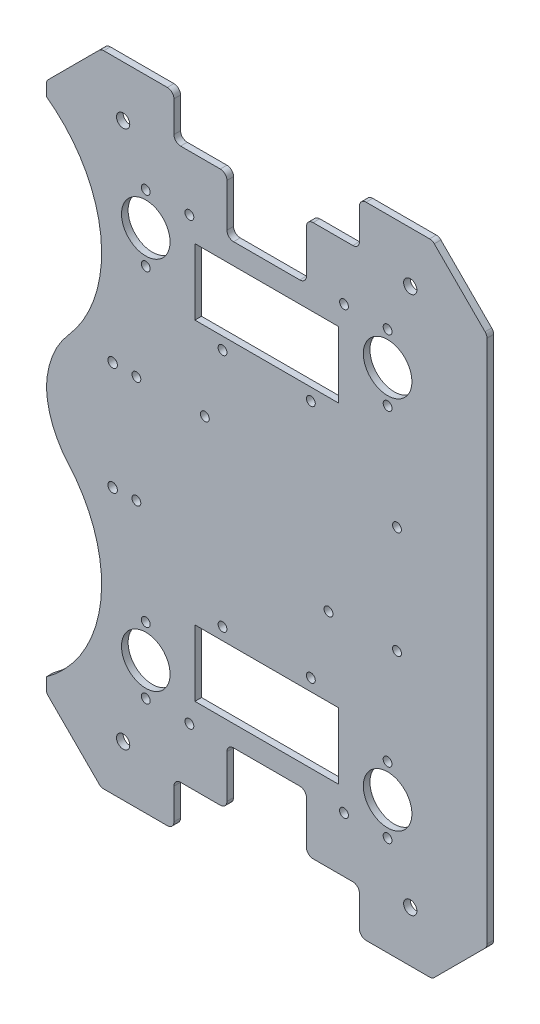
from build123d import *

# Parameters (mm, degrees)
BASE_DEPTH                = 3
ESQUISSE3_R               = 2
ESQUISSE3_W               = 65
ESQUISSE3_H               = 30
ENL_V_MAT_EXTRU_1_DEPTH   = 339.164026842
CONG_1_R                  = 3
PER_AGE_POUR_BILLES_REACH = 340.164
ESQUISSE6_R               = 2
ESQUISSE6_R_2             = 11
PER_AGE_POUR_PROFIL_REACH = 340.164
ESQUISSE8_R               = 3
ESQUISSE11_R              = 2.15
ENL_V_MAT_EXTRU_4_DEPTH   = 339.164026842
ENL_V_MAT_EXTRU_5_REACH   = 340.164
ESQUISSE12_R              = 60
CONG_2_R                  = 40
PER_AGE_BLOC_MOTEUR_REACH = 340.164
ESQUISSE13_R              = 2


with BuildPart() as part:
    # Esquisse1 → Base (new body)
    with BuildSketch(Plane.XY):
        Polygon((0, 0), (-150, 0), (-174.748737342, 24.748737342), (-174.748737342, 264.748737342), (-150, 289.497474683), (0, 289.497474683), (24.748737342, 264.748737342), (24.748737342, 24.748737342), align=None)
    extrude(amount=BASE_DEPTH)

    # Esquisse3 → Enlèv. mat.-Extru.1 (cut, through all)
    with BuildSketch(Plane(origin=(0, 0, 0), x_dir=(-1, 0, 0), z_dir=(0, 0, -1))):
        with Locations((40, 45)):
            Circle(ESQUISSE3_R)
        with Locations(Location((110, 45, 0), (0, 0, 180))):
            Circle(ESQUISSE3_R)
        with Locations((110, 244.497474683)):
            Circle(ESQUISSE3_R)
        with Locations(Location((40, 244.497474683, 0), (0, 0, 180))):
            Circle(ESQUISSE3_R)
        Polygon((117, 0), (117, 20), (93, 20), (93, 45.5), (57, 45.5), (57, 20), (33, 20), (33, 0), align=None)
        Polygon((33, 289.497474683), (117, 289.497474683), (117, 269.497474683), (93, 269.497474683), (93, 243.997474683), (57, 243.997474683), (57, 269.497474683), (33, 269.497474683), align=None)
        with Locations((75, 219.497474683)):
            Rectangle(ESQUISSE3_W, ESQUISSE3_H)
        with Locations((75, 70)):
            Rectangle(ESQUISSE3_W, ESQUISSE3_H)
    extrude(amount=-ENL_V_MAT_EXTRU_1_DEPTH, mode=Mode.SUBTRACT)

    # Congé1
    cong_1_edges = [part.edges().sort_by_distance(p)[0] for p in [
        (0, 0, 1.5),
        (-150, 0, 1.5),
        (-174.748737342, 24.748737342, 1.5),
        (-174.748737342, 264.748737342, 1.5),
        (-150, 289.497474683, 1.5),
        (0, 289.497474683, 1.5),
        (24.748737342, 264.748737342, 1.5),
        (24.748737342, 24.748737342, 1.5),
        (-33, 269.497474683, 1.5),
        (-33, 289.497474683, 1.5),
        (-117, 289.497474683, 1.5),
        (-117, 269.497474683, 1.5),
        (-93, 269.497474683, 1.5),
        (-93, 243.997474683, 1.5),
        (-57, 243.997474683, 1.5),
        (-57, 269.497474683, 1.5),
        (-117, 0, 1.5),
        (-33, 0, 1.5),
        (-33, 20, 1.5),
        (-57, 20, 1.5),
        (-57, 45.5, 1.5),
        (-93, 45.5, 1.5),
        (-93, 20, 1.5),
        (-117, 20, 1.5),
    ]]
    fillet(cong_1_edges, radius=CONG_1_R)

    # Esquisse6 → Perçage pour billes (cut, up to next)
    with BuildSketch(Plane.XY.offset(3), mode=Mode.PRIVATE) as per_age_pour_billes_sk1:
        with Locations((-129.748737342, 45)):
            Circle(ESQUISSE6_R)
    per_age_pour_billes_tool1 = extrude(per_age_pour_billes_sk1.sketch, amount=-PER_AGE_POUR_BILLES_REACH, mode=Mode.PRIVATE) & part.part
    # Esquisse6 → Perçage pour billes (cut, up to next)
    with BuildSketch(Plane.XY.offset(3), mode=Mode.PRIVATE) as per_age_pour_billes_sk2:
        with Locations((-129.748737342, 75)):
            Circle(ESQUISSE6_R)
    per_age_pour_billes_tool2 = extrude(per_age_pour_billes_sk2.sketch, amount=-PER_AGE_POUR_BILLES_REACH, mode=Mode.PRIVATE) & part.part
    # Esquisse6 → Perçage pour billes (cut, up to next)
    with BuildSketch(Plane.XY.offset(3), mode=Mode.PRIVATE) as per_age_pour_billes_sk3:
        with Locations((-129.748737342, 60)):
            Circle(ESQUISSE6_R_2)
    per_age_pour_billes_tool3 = extrude(per_age_pour_billes_sk3.sketch, amount=-PER_AGE_POUR_BILLES_REACH, mode=Mode.PRIVATE) & part.part
    # Esquisse6 → Perçage pour billes (cut, up to next)
    with BuildSketch(Plane.XY.offset(3), mode=Mode.PRIVATE) as per_age_pour_billes_sk4:
        with Locations((-20.251262658, 45)):
            Circle(ESQUISSE6_R)
    per_age_pour_billes_tool4 = extrude(per_age_pour_billes_sk4.sketch, amount=-PER_AGE_POUR_BILLES_REACH, mode=Mode.PRIVATE) & part.part
    # Esquisse6 → Perçage pour billes (cut, up to next)
    with BuildSketch(Plane.XY.offset(3), mode=Mode.PRIVATE) as per_age_pour_billes_sk5:
        with Locations((-20.251262658, 75)):
            Circle(ESQUISSE6_R)
    per_age_pour_billes_tool5 = extrude(per_age_pour_billes_sk5.sketch, amount=-PER_AGE_POUR_BILLES_REACH, mode=Mode.PRIVATE) & part.part
    # Esquisse6 → Perçage pour billes (cut, up to next)
    with BuildSketch(Plane.XY.offset(3), mode=Mode.PRIVATE) as per_age_pour_billes_sk6:
        with Locations((-20.251262658, 60)):
            Circle(ESQUISSE6_R_2)
    per_age_pour_billes_tool6 = extrude(per_age_pour_billes_sk6.sketch, amount=-PER_AGE_POUR_BILLES_REACH, mode=Mode.PRIVATE) & part.part
    # Esquisse6 → Perçage pour billes (cut, up to next)
    with BuildSketch(Plane.XY.offset(3), mode=Mode.PRIVATE) as per_age_pour_billes_sk7:
        with Locations((-20.251262658, 229.497474683)):
            Circle(ESQUISSE6_R_2)
    per_age_pour_billes_tool7 = extrude(per_age_pour_billes_sk7.sketch, amount=-PER_AGE_POUR_BILLES_REACH, mode=Mode.PRIVATE) & part.part
    # Esquisse6 → Perçage pour billes (cut, up to next)
    with BuildSketch(Plane.XY.offset(3), mode=Mode.PRIVATE) as per_age_pour_billes_sk8:
        with Locations((-20.251262658, 214.497474683)):
            Circle(ESQUISSE6_R)
    per_age_pour_billes_tool8 = extrude(per_age_pour_billes_sk8.sketch, amount=-PER_AGE_POUR_BILLES_REACH, mode=Mode.PRIVATE) & part.part
    # Esquisse6 → Perçage pour billes (cut, up to next)
    with BuildSketch(Plane.XY.offset(3), mode=Mode.PRIVATE) as per_age_pour_billes_sk9:
        with Locations((-20.251262658, 244.497474683)):
            Circle(ESQUISSE6_R)
    per_age_pour_billes_tool9 = extrude(per_age_pour_billes_sk9.sketch, amount=-PER_AGE_POUR_BILLES_REACH, mode=Mode.PRIVATE) & part.part
    # Esquisse6 → Perçage pour billes (cut, up to next)
    with BuildSketch(Plane.XY.offset(3), mode=Mode.PRIVATE) as per_age_pour_billes_sk10:
        with Locations((-129.748737342, 229.497474683)):
            Circle(ESQUISSE6_R_2)
    per_age_pour_billes_tool10 = extrude(per_age_pour_billes_sk10.sketch, amount=-PER_AGE_POUR_BILLES_REACH, mode=Mode.PRIVATE) & part.part
    # Esquisse6 → Perçage pour billes (cut, up to next)
    with BuildSketch(Plane.XY.offset(3), mode=Mode.PRIVATE) as per_age_pour_billes_sk11:
        with Locations((-129.748737342, 214.497474683)):
            Circle(ESQUISSE6_R)
    per_age_pour_billes_tool11 = extrude(per_age_pour_billes_sk11.sketch, amount=-PER_AGE_POUR_BILLES_REACH, mode=Mode.PRIVATE) & part.part
    # Esquisse6 → Perçage pour billes (cut, up to next)
    with BuildSketch(Plane.XY.offset(3), mode=Mode.PRIVATE) as per_age_pour_billes_sk12:
        with Locations((-129.748737342, 244.497474683)):
            Circle(ESQUISSE6_R)
    per_age_pour_billes_tool12 = extrude(per_age_pour_billes_sk12.sketch, amount=-PER_AGE_POUR_BILLES_REACH, mode=Mode.PRIVATE) & part.part
    add(per_age_pour_billes_tool1.solids().sort_by_distance((-129.748737, 45, 3))[0], mode=Mode.SUBTRACT)
    add(per_age_pour_billes_tool2.solids().sort_by_distance((-129.748737, 75, 3))[0], mode=Mode.SUBTRACT)
    add(per_age_pour_billes_tool3.solids().sort_by_distance((-129.748737, 60, 3))[0], mode=Mode.SUBTRACT)
    add(per_age_pour_billes_tool4.solids().sort_by_distance((-20.251263, 45, 3))[0], mode=Mode.SUBTRACT)
    add(per_age_pour_billes_tool5.solids().sort_by_distance((-20.251263, 75, 3))[0], mode=Mode.SUBTRACT)
    add(per_age_pour_billes_tool6.solids().sort_by_distance((-20.251263, 60, 3))[0], mode=Mode.SUBTRACT)
    add(per_age_pour_billes_tool7.solids().sort_by_distance((-20.251263, 229.497475, 3))[0], mode=Mode.SUBTRACT)
    add(per_age_pour_billes_tool8.solids().sort_by_distance((-20.251263, 214.497475, 3))[0], mode=Mode.SUBTRACT)
    add(per_age_pour_billes_tool9.solids().sort_by_distance((-20.251263, 244.497475, 3))[0], mode=Mode.SUBTRACT)
    add(per_age_pour_billes_tool10.solids().sort_by_distance((-129.748737, 229.497475, 3))[0], mode=Mode.SUBTRACT)
    add(per_age_pour_billes_tool11.solids().sort_by_distance((-129.748737, 214.497475, 3))[0], mode=Mode.SUBTRACT)
    add(per_age_pour_billes_tool12.solids().sort_by_distance((-129.748737, 244.497475, 3))[0], mode=Mode.SUBTRACT)

    # Esquisse8 → Perçage pour profilé (cut, up to next)
    with BuildSketch(Plane.XY.offset(3), mode=Mode.PRIVATE) as per_age_pour_profil_sk1:
        with Locations((-140, 23)):
            Circle(ESQUISSE8_R)
    per_age_pour_profil_tool1 = extrude(per_age_pour_profil_sk1.sketch, amount=-PER_AGE_POUR_PROFIL_REACH, mode=Mode.PRIVATE) & part.part
    # Esquisse8 → Perçage pour profilé (cut, up to next)
    with BuildSketch(Plane.XY.offset(3), mode=Mode.PRIVATE) as per_age_pour_profil_sk2:
        with Locations((-140, 266.497474683)):
            Circle(ESQUISSE8_R)
    per_age_pour_profil_tool2 = extrude(per_age_pour_profil_sk2.sketch, amount=-PER_AGE_POUR_PROFIL_REACH, mode=Mode.PRIVATE) & part.part
    # Esquisse8 → Perçage pour profilé (cut, up to next)
    with BuildSketch(Plane.XY.offset(3), mode=Mode.PRIVATE) as per_age_pour_profil_sk3:
        with Locations((-10, 266.497474683)):
            Circle(ESQUISSE8_R)
    per_age_pour_profil_tool3 = extrude(per_age_pour_profil_sk3.sketch, amount=-PER_AGE_POUR_PROFIL_REACH, mode=Mode.PRIVATE) & part.part
    # Esquisse8 → Perçage pour profilé (cut, up to next)
    with BuildSketch(Plane.XY.offset(3), mode=Mode.PRIVATE) as per_age_pour_profil_sk4:
        with Locations((-10, 23)):
            Circle(ESQUISSE8_R)
    per_age_pour_profil_tool4 = extrude(per_age_pour_profil_sk4.sketch, amount=-PER_AGE_POUR_PROFIL_REACH, mode=Mode.PRIVATE) & part.part
    add(per_age_pour_profil_tool1.solids().sort_by_distance((-140, 23, 3))[0], mode=Mode.SUBTRACT)
    add(per_age_pour_profil_tool2.solids().sort_by_distance((-140, 266.497475, 3))[0], mode=Mode.SUBTRACT)
    add(per_age_pour_profil_tool3.solids().sort_by_distance((-10, 266.497475, 3))[0], mode=Mode.SUBTRACT)
    add(per_age_pour_profil_tool4.solids().sort_by_distance((-10, 23, 3))[0], mode=Mode.SUBTRACT)

    # Esquisse11 → Enlèv. mat.-Extru.4 (cut, through all)
    with BuildSketch(Plane.XY.offset(3)):
        with Locations((-144.748737342, 169.248737342)):
            Circle(ESQUISSE11_R)
        with Locations((-144.748737342, 120.248737342)):
            Circle(ESQUISSE11_R)
    extrude(amount=-ENL_V_MAT_EXTRU_4_DEPTH, mode=Mode.SUBTRACT)

    # Esquisse12 → Enlèv. mat.-Extru.5 (cut, up to next)
    with BuildSketch(Plane.XY.offset(3), mode=Mode.PRIVATE) as enl_v_mat_extru_5_sk1:
        with Locations((-209.748737342, 209.748737342)):
            Circle(ESQUISSE12_R)
    enl_v_mat_extru_5_tool1 = extrude(enl_v_mat_extru_5_sk1.sketch, amount=-ENL_V_MAT_EXTRU_5_REACH, mode=Mode.PRIVATE) & part.part
    # Esquisse12 → Enlèv. mat.-Extru.5 (cut, up to next)
    with BuildSketch(Plane.XY.offset(3), mode=Mode.PRIVATE) as enl_v_mat_extru_5_sk2:
        with Locations((-209.748737342, 79.748737342)):
            Circle(ESQUISSE12_R)
    enl_v_mat_extru_5_tool2 = extrude(enl_v_mat_extru_5_sk2.sketch, amount=-ENL_V_MAT_EXTRU_5_REACH, mode=Mode.PRIVATE) & part.part
    add(enl_v_mat_extru_5_tool1.solids().sort_by_distance((-209.748737, 209.748737, 3))[0], mode=Mode.SUBTRACT)
    add(enl_v_mat_extru_5_tool2.solids().sort_by_distance((-209.748737, 79.748737, 3))[0], mode=Mode.SUBTRACT)

    # Congé2
    # the kernel refuses this fillet: 40 mm, written as the material it takes off along each edge
    with BuildSketch(Plane(origin=(-174.748737342, 128.482709066, -43.524527631), x_dir=(0, 1, 0), z_dir=(0, 0, 1))) as cong_2_piece_1:
        with BuildLine():
            CenterArc((17.409811053, -40), CONG_2_R, 90, 41.409622109)
            ThreePointArc((-9.047702058, -10), (-4.242008721, -5.255002523), (0, 0))
            Line((0, 0), (17.409811053, 0))
        make_face()
    extrude(amount=90.049055263, mode=Mode.SUBTRACT)
    with BuildSketch(Plane(origin=(-174.748737342, 161.014765617, -43.524527631), x_dir=(0.7415327167179309, 0.6709167087179488, 0), z_dir=(0, 0, 1))) as cong_2_piece_2:
        with BuildLine():
            CenterArc((17.980775538, -39.746612836), CONG_2_R, 96.452521589, 41.409622109)
            Line((-11.680533131, -12.909944487), (0, 0))
            ThreePointArc((0, 0), (6.742790827, -0.380080746), (13.485581653, 0))
        make_face()
    extrude(amount=90.049055263, mode=Mode.SUBTRACT)

    # Esquisse13 → Perçage bloc moteur (cut, up to next)
    with BuildSketch(Plane(origin=(0, 0, 0), x_dir=(-1, 0, 0), z_dir=(0, 0, -1)), mode=Mode.PRIVATE) as per_age_bloc_moteur_sk1:
        with Locations((95, 198.997474683)):
            Circle(ESQUISSE13_R)
    per_age_bloc_moteur_tool1 = extrude(per_age_bloc_moteur_sk1.sketch, amount=-PER_AGE_BLOC_MOTEUR_REACH, mode=Mode.PRIVATE) & part.part
    # Esquisse13 → Perçage bloc moteur (cut, up to next)
    with BuildSketch(Plane(origin=(0, 0, 0), x_dir=(-1, 0, 0), z_dir=(0, 0, -1)), mode=Mode.PRIVATE) as per_age_bloc_moteur_sk2:
        with Locations((134, 168.997474683)):
            Circle(ESQUISSE13_R)
    per_age_bloc_moteur_tool2 = extrude(per_age_bloc_moteur_sk2.sketch, amount=-PER_AGE_BLOC_MOTEUR_REACH, mode=Mode.PRIVATE) & part.part
    # Esquisse13 → Perçage bloc moteur (cut, up to next)
    with BuildSketch(Plane(origin=(0, 0, 0), x_dir=(-1, 0, 0), z_dir=(0, 0, -1)), mode=Mode.PRIVATE) as per_age_bloc_moteur_sk3:
        with Locations((103, 168.997474683)):
            Circle(ESQUISSE13_R)
    per_age_bloc_moteur_tool3 = extrude(per_age_bloc_moteur_sk3.sketch, amount=-PER_AGE_BLOC_MOTEUR_REACH, mode=Mode.PRIVATE) & part.part
    # Esquisse13 → Perçage bloc moteur (cut, up to next)
    with BuildSketch(Plane(origin=(0, 0, 0), x_dir=(-1, 0, 0), z_dir=(0, 0, -1)), mode=Mode.PRIVATE) as per_age_bloc_moteur_sk4:
        with Locations((55, 198.997474683)):
            Circle(ESQUISSE13_R)
    per_age_bloc_moteur_tool4 = extrude(per_age_bloc_moteur_sk4.sketch, amount=-PER_AGE_BLOC_MOTEUR_REACH, mode=Mode.PRIVATE) & part.part
    # Esquisse13 → Perçage bloc moteur (cut, up to next)
    with BuildSketch(Plane(origin=(0, 0, 0), x_dir=(-1, 0, 0), z_dir=(0, 0, -1)), mode=Mode.PRIVATE) as per_age_bloc_moteur_sk5:
        with Locations((16, 168.997474683)):
            Circle(ESQUISSE13_R)
    per_age_bloc_moteur_tool5 = extrude(per_age_bloc_moteur_sk5.sketch, amount=-PER_AGE_BLOC_MOTEUR_REACH, mode=Mode.PRIVATE) & part.part
    # Esquisse13 → Perçage bloc moteur (cut, up to next)
    with BuildSketch(Plane(origin=(0, 0, 0), x_dir=(-1, 0, 0), z_dir=(0, 0, -1)), mode=Mode.PRIVATE) as per_age_bloc_moteur_sk6:
        with Locations((47, 120.5)):
            Circle(ESQUISSE13_R)
    per_age_bloc_moteur_tool6 = extrude(per_age_bloc_moteur_sk6.sketch, amount=-PER_AGE_BLOC_MOTEUR_REACH, mode=Mode.PRIVATE) & part.part
    # Esquisse13 → Perçage bloc moteur (cut, up to next)
    with BuildSketch(Plane(origin=(0, 0, 0), x_dir=(-1, 0, 0), z_dir=(0, 0, -1)), mode=Mode.PRIVATE) as per_age_bloc_moteur_sk7:
        with Locations((55, 90.5)):
            Circle(ESQUISSE13_R)
    per_age_bloc_moteur_tool7 = extrude(per_age_bloc_moteur_sk7.sketch, amount=-PER_AGE_BLOC_MOTEUR_REACH, mode=Mode.PRIVATE) & part.part
    # Esquisse13 → Perçage bloc moteur (cut, up to next)
    with BuildSketch(Plane(origin=(0, 0, 0), x_dir=(-1, 0, 0), z_dir=(0, 0, -1)), mode=Mode.PRIVATE) as per_age_bloc_moteur_sk8:
        with Locations((95, 90.5)):
            Circle(ESQUISSE13_R)
    per_age_bloc_moteur_tool8 = extrude(per_age_bloc_moteur_sk8.sketch, amount=-PER_AGE_BLOC_MOTEUR_REACH, mode=Mode.PRIVATE) & part.part
    # Esquisse13 → Perçage bloc moteur (cut, up to next)
    with BuildSketch(Plane(origin=(0, 0, 0), x_dir=(-1, 0, 0), z_dir=(0, 0, -1)), mode=Mode.PRIVATE) as per_age_bloc_moteur_sk9:
        with Locations((16, 120.5)):
            Circle(ESQUISSE13_R)
    per_age_bloc_moteur_tool9 = extrude(per_age_bloc_moteur_sk9.sketch, amount=-PER_AGE_BLOC_MOTEUR_REACH, mode=Mode.PRIVATE) & part.part
    # Esquisse13 → Perçage bloc moteur (cut, up to next)
    with BuildSketch(Plane(origin=(0, 0, 0), x_dir=(-1, 0, 0), z_dir=(0, 0, -1)), mode=Mode.PRIVATE) as per_age_bloc_moteur_sk10:
        with Locations((134, 120.5)):
            Circle(ESQUISSE13_R)
    per_age_bloc_moteur_tool10 = extrude(per_age_bloc_moteur_sk10.sketch, amount=-PER_AGE_BLOC_MOTEUR_REACH, mode=Mode.PRIVATE) & part.part
    add(per_age_bloc_moteur_tool1.solids().sort_by_distance((-95, 198.997475, 0))[0], mode=Mode.SUBTRACT)
    add(per_age_bloc_moteur_tool2.solids().sort_by_distance((-134, 168.997475, 0))[0], mode=Mode.SUBTRACT)
    add(per_age_bloc_moteur_tool3.solids().sort_by_distance((-103, 168.997475, 0))[0], mode=Mode.SUBTRACT)
    add(per_age_bloc_moteur_tool4.solids().sort_by_distance((-55, 198.997475, 0))[0], mode=Mode.SUBTRACT)
    add(per_age_bloc_moteur_tool5.solids().sort_by_distance((-16, 168.997475, 0))[0], mode=Mode.SUBTRACT)
    add(per_age_bloc_moteur_tool6.solids().sort_by_distance((-47, 120.5, 0))[0], mode=Mode.SUBTRACT)
    add(per_age_bloc_moteur_tool7.solids().sort_by_distance((-55, 90.5, 0))[0], mode=Mode.SUBTRACT)
    add(per_age_bloc_moteur_tool8.solids().sort_by_distance((-95, 90.5, 0))[0], mode=Mode.SUBTRACT)
    add(per_age_bloc_moteur_tool9.solids().sort_by_distance((-16, 120.5, 0))[0], mode=Mode.SUBTRACT)
    add(per_age_bloc_moteur_tool10.solids().sort_by_distance((-134, 120.5, 0))[0], mode=Mode.SUBTRACT)


solid = part.part
